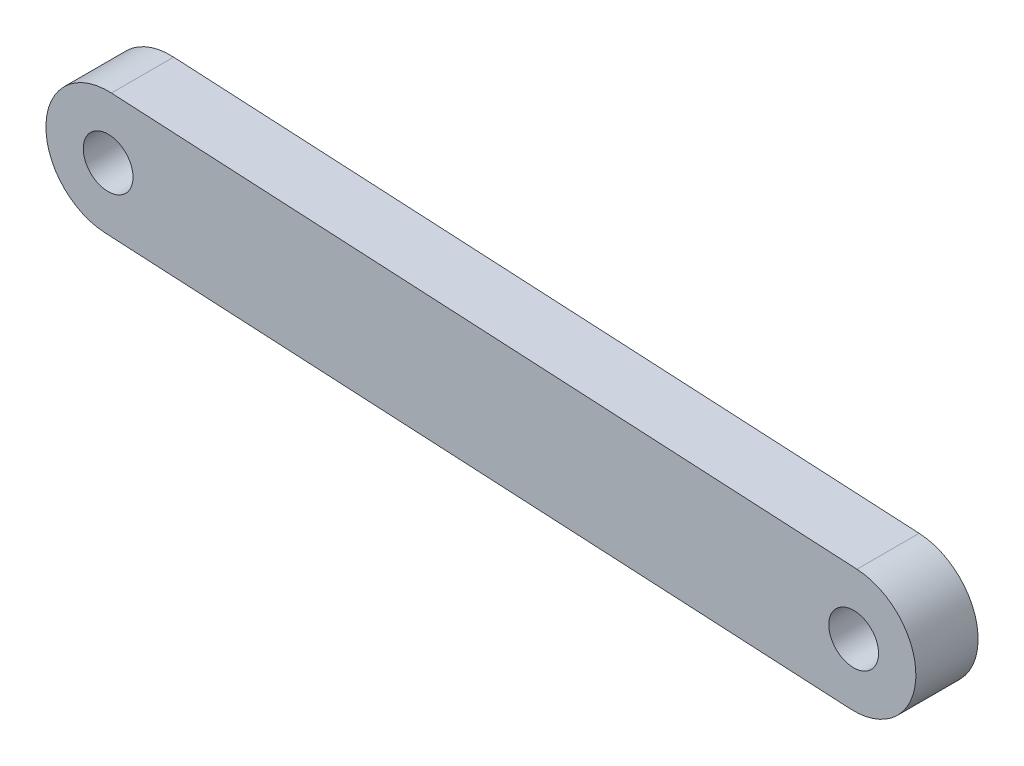
from build123d import *

# Parameters (mm, degrees)
SKETCH1_R           = 2
BOSS_EXTRUDE1_DEPTH = 5


with BuildPart() as part:
    # Sketch1 → Boss-Extrude1 (new body)
    with BuildSketch(Plane(origin=(0, 0, 0), x_dir=(0.4311817754230788, 0.9022650810837144, 0), z_dir=(0, 0, 1))):
        with BuildLine():
            Line((-18.654834307, 30.177729369), (-41.615840249, 85.610501319))
            ThreePointArc((-41.615840249, 85.610501319), (-48.148655073, 88.31648182), (-50.854635574, 81.783666996))
            Line((-50.854635574, 81.783666996), (-27.893629632, 26.350895045))
            ThreePointArc((-27.893629632, 26.350895045), (-21.360814808, 23.644914544), (-18.654834307, 30.177729369))
        make_face()
        with Locations((-23.27423197, 28.264312207)):
            Circle(SKETCH1_R, mode=Mode.SUBTRACT)
        with Locations((-46.235237911, 83.697084158)):
            Circle(SKETCH1_R, mode=Mode.SUBTRACT)
    extrude(amount=BOSS_EXTRUDE1_DEPTH)


solid = part.part
